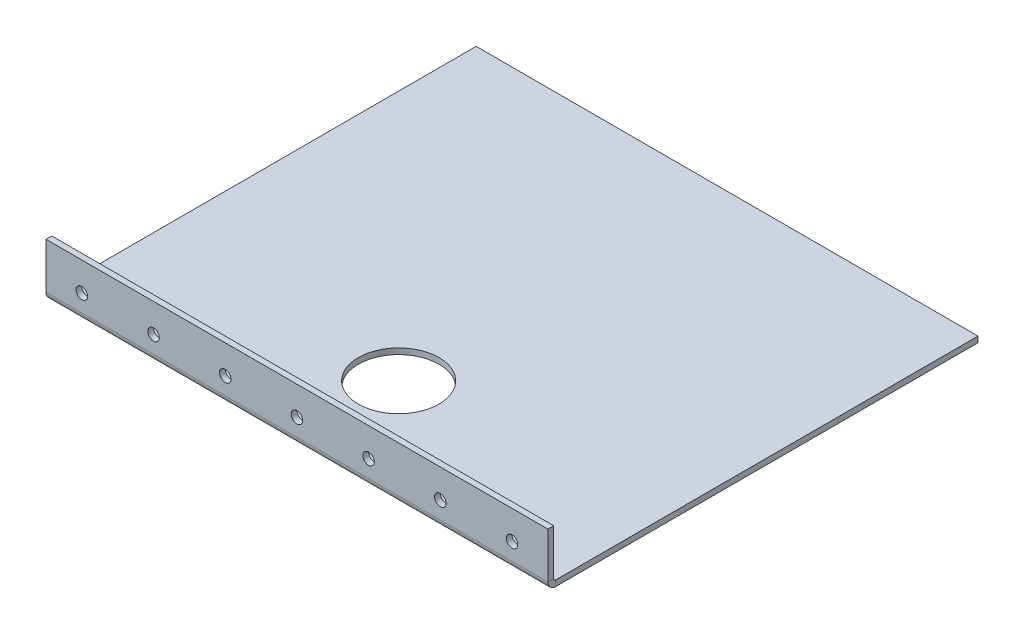
from build123d import *

# Parameters (mm, degrees)
SKETCH1_W                    = 177.8
SKETCH1_H                    = 152.4
BASE_FLANGE1_DEPTH           = 2.05232
EDGE_FLANGE1_STRIP_W         = 9.68248
EDGE_FLANGE1_STRIP_H         = 2.05232
EDGE_FLANGE1_STRIP_CUT_DEPTH = 177.8
EDGE_FLANGE1_DEPTH           = 177.8
SKETCH9_R                    = 2.032
CUT_EXTRUDE1_DEPTH           = 2.54
SKETCH10_R                   = 14.2875
CUT_EXTRUDE2_DEPTH           = 2.54


# Sheet-metal steps are written as plain solids
with BuildPart() as part:
    # Sketch1 → Base-Flange1 (new body)
    with BuildSketch(Plane(origin=(0, 0, 0), x_dir=(1, 0, 0), z_dir=(0, 1, 0))):
        with Locations((-5549.9, 2677.885714286)):
            Rectangle(SKETCH1_W, SKETCH1_H)
    extrude(amount=-BASE_FLANGE1_DEPTH)

    # Edge-Flange1 strip (across the edge) → Edge-Flange1 strip cut (cut)
    with BuildSketch(Plane(origin=(-5638.8, 0, -2601.685714286), x_dir=(0, 0, -1), z_dir=(1, 0, 0))):
        with Locations((-2.05232, -1.02616)):
            Rectangle(EDGE_FLANGE1_STRIP_W, EDGE_FLANGE1_STRIP_H)
    extrude(amount=EDGE_FLANGE1_STRIP_CUT_DEPTH, mode=Mode.SUBTRACT)

    # Edge-Flange1 section (across the edge) → Edge-Flange1 (add)
    with BuildSketch(Plane(origin=(-5638.8, 0, -2601.685714286), x_dir=(0, 0, -1), z_dir=(1, 0, 0))):
        with BuildLine():
            Line((0, 0.7366), (0, 16.99768))
            Line((0, 16.99768), (2.05232, 16.99768))
            Line((2.05232, 16.99768), (2.05232, 0.7366))
            ThreePointArc((2.05232, 0.7366), (2.268065145, 0.215745145), (2.78892, 0))
            Line((2.78892, 0), (2.78892, -2.05232))
            ThreePointArc((2.78892, -2.05232), (0.816855756, -1.235464244), (0, 0.7366))
        make_face()
    extrude(amount=EDGE_FLANGE1_DEPTH)

    # Sketch9 → Cut-Extrude1 (cut)
    with BuildSketch(Plane(origin=(0, 0, -2603.738034286), x_dir=(-1, 0, 0), z_dir=(0, 0, -1))):
        with Locations((5626.1, 6.83768)):
            Circle(SKETCH9_R)
        with Locations((5600.7, 6.83768)):
            Circle(SKETCH9_R)
        with Locations((5575.3, 6.83768)):
            Circle(SKETCH9_R)
        with Locations((5549.9, 6.83768)):
            Circle(SKETCH9_R)
        with Locations((5524.5, 6.83768)):
            Circle(SKETCH9_R)
        with Locations((5499.1, 6.83768)):
            Circle(SKETCH9_R)
        with Locations((5473.7, 6.83768)):
            Circle(SKETCH9_R)
    extrude(amount=-CUT_EXTRUDE1_DEPTH, mode=Mode.SUBTRACT)

    # Sketch10 → Cut-Extrude2 (cut)
    with BuildSketch(Plane.XZ.offset(2.05232)):
        with Locations(Location((-5549.9, -2637.733394286, 0), (0, 0, 270))):
            Circle(SKETCH10_R)
    extrude(amount=-CUT_EXTRUDE2_DEPTH, mode=Mode.SUBTRACT)


solid = part.part
